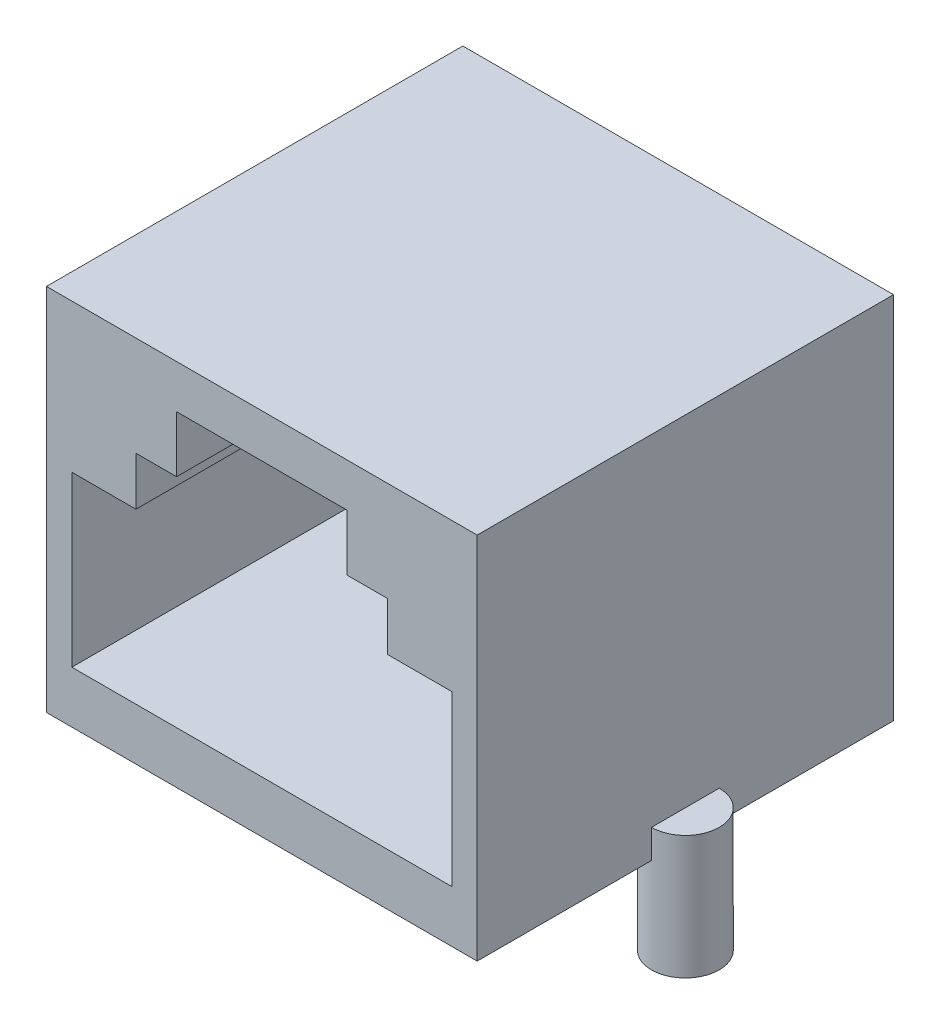
from build123d import *

# Parameters (mm, degrees)
SKETCH_1_W           = 15
SKETCH_1_H           = 14.5
EXTRUDE_1_DEPTH      = 12.85
EXTRUDE_2_DEPTH      = 3.3
EXTRUDE_2_DEPTH_BACK = 1
SKETCH_2_R           = 1.18
CUT_EXTRUDE_1_DEPTH  = 10


with BuildPart() as part:
    # 草图1 → 凸台-拉伸1 (new body)
    with BuildSketch(Plane(origin=(0, 0, 0), x_dir=(1, 0, 0), z_dir=(0, 1, 0))):
        Rectangle(SKETCH_1_W, SKETCH_1_H)
    extrude(amount=EXTRUDE_1_DEPTH)

    # 草图2 → 凸台-拉伸2 (add, two sides: drawn at the far end of the back side and taken through both)
    with BuildSketch(Plane.XZ.offset(-EXTRUDE_2_DEPTH_BACK)):
        with Locations((-7.5, 0)):
            Circle(SKETCH_2_R)
        with Locations((7.5, 0)):
            Circle(SKETCH_2_R)
    extrude(amount=EXTRUDE_2_DEPTH + EXTRUDE_2_DEPTH_BACK)

    # 草图3 → 切除-拉伸1 (cut)
    with BuildSketch(Plane.XY.offset(7.25)):
        Polygon((2.967608293, 11.336409161), (-2.967608293, 11.336409161), (-2.967608293, 9.376154142), (-4.383348029, 9.376154142), (-4.383348029, 7.688156764), (-6.615860689, 7.688156764), (-6.615860689, 1.807391707), (6.615860689, 1.807391707), (6.615860689, 7.688156764), (4.383348029, 7.688156764), (4.383348029, 9.376154142), (2.967608293, 9.376154142), align=None)
    extrude(amount=-CUT_EXTRUDE_1_DEPTH, mode=Mode.SUBTRACT)


solid = part.part
